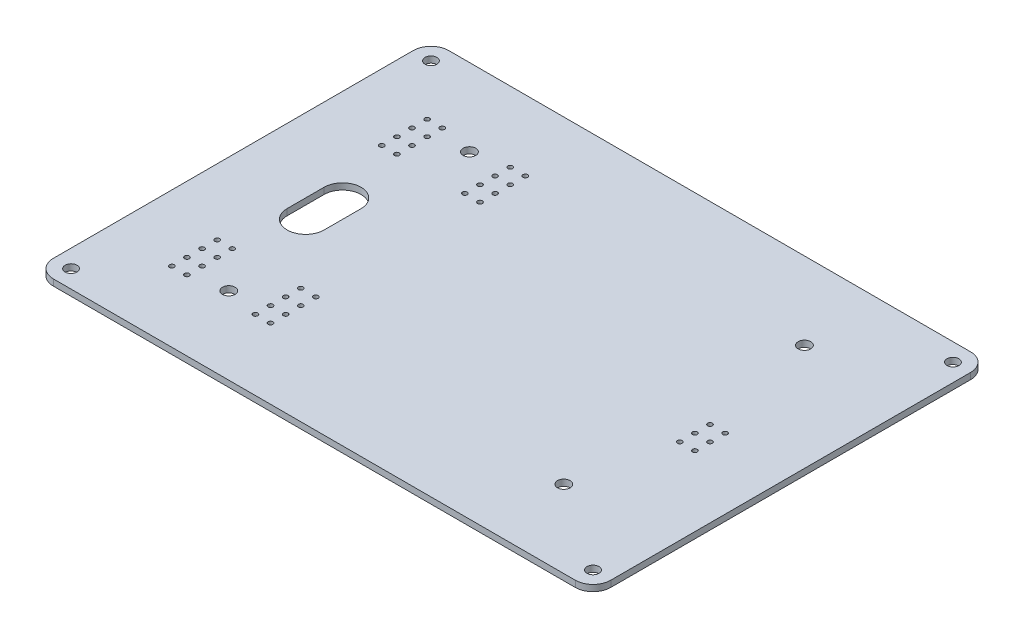
from build123d import *

# Parameters (mm, degrees)
BOSS_EXTRUDE1_DEPTH = 1.5875
SKETCH2_R           = 1.5875
CUT_EXTRUDE1_DEPTH  = 87.546171446
CUT_EXTRUDE2_DEPTH  = 87.546171446
SKETCH7_R           = 0.6
CUT_EXTRUDE3_DEPTH  = 87.546171446
SKETCH9_R           = 1.5
CUT_EXTRUDE4_DEPTH  = 87.546171446


with BuildPart() as part:
    # Sketch1 → Boss-Extrude1 (new body)
    with BuildSketch(Plane(origin=(0, 0, 0), x_dir=(1, 0, 0), z_dir=(0, 1, 0))):
        with BuildLine():
            Line((-65.410639449, -49.868760551), (66.237560551, -49.868760551))
            ThreePointArc((66.237560551, -49.868760551), (69.404663929, -48.556903378), (70.716521102, -45.3898))
            Line((70.716521102, -45.3898), (70.716521102, 45.3898))
            ThreePointArc((70.716521102, 45.3898), (69.404663929, 48.556903378), (66.237560551, 49.868760551))
            Line((66.237560551, 49.868760551), (-65.410639449, 49.868760551))
            ThreePointArc((-65.410639449, 49.868760551), (-68.577742827, 48.556903378), (-69.8896, 45.3898))
            Line((-69.8896, 45.3898), (-69.8896, -45.3898))
            ThreePointArc((-69.8896, -45.3898), (-68.577742827, -48.556903378), (-65.410639449, -49.868760551))
        make_face()
    extrude(amount=-BOSS_EXTRUDE1_DEPTH)

    # Sketch2 → Cut-Extrude1 (cut, through all)
    with BuildSketch(Plane(origin=(0, 0, 0), x_dir=(1, 0, 0), z_dir=(0, 1, 0))):
        with Locations((-40.6725, -30.35)):
            Circle(SKETCH2_R)
        with Locations((-40.6725, 30.35)):
            Circle(SKETCH2_R)
        with Locations((43.8275, 30.35)):
            Circle(SKETCH2_R)
        with Locations((43.8275, -30.35)):
            Circle(SKETCH2_R)
    extrude(amount=-CUT_EXTRUDE1_DEPTH, mode=Mode.SUBTRACT)

    # Sketch3 → Cut-Extrude2 (cut, through all)
    with BuildSketch(Plane(origin=(0, 0, 0), x_dir=(1, 0, 0), z_dir=(0, 1, 0))):
        with BuildLine():
            Line((-41.933471413, 4.284952831), (-41.933471413, -5.034952831))
            ThreePointArc((-41.933471413, -5.034952831), (-46.603471413, -9.704952831), (-51.273471413, -5.034952831))
            Line((-51.273471413, -5.034952831), (-51.273471413, 4.284952831))
            ThreePointArc((-51.273471413, 4.284952831), (-46.603471413, 8.954952831), (-41.933471413, 4.284952831))
        make_face()
    extrude(amount=-CUT_EXTRUDE2_DEPTH, mode=Mode.SUBTRACT)

    # Sketch7 → Cut-Extrude3 (cut, through all)
    with BuildSketch(Plane.XZ.offset(1.5875)):
        with Locations((49.2175, 6.483)):
            Circle(SKETCH7_R)
        with Locations((-49.3085, -32.125)):
            Circle(SKETCH7_R)
        with Locations((-28.3535, -32.125)):
            Circle(SKETCH7_R)
        with Locations((-28.3535, 20.707)):
            Circle(SKETCH7_R)
        with Locations((-49.4355, 20.707)):
            Circle(SKETCH7_R)
        with Locations((-32.1635, 20.707)):
            Circle(SKETCH7_R)
        with Locations((-53.2455, 20.707)):
            Circle(SKETCH7_R)
        with Locations((-32.1635, 28.327)):
            Circle(SKETCH7_R)
        with Locations((-53.2455, 28.327)):
            Circle(SKETCH7_R)
        with Locations((-32.1635, 24.517)):
            Circle(SKETCH7_R)
        with Locations((-53.2455, 24.517)):
            Circle(SKETCH7_R)
        with Locations((-32.1635, -28.315)):
            Circle(SKETCH7_R)
        with Locations((-53.1185, -28.315)):
            Circle(SKETCH7_R)
        with Locations((-32.1635, -32.125)):
            Circle(SKETCH7_R)
        with Locations((-53.1185, -32.125)):
            Circle(SKETCH7_R)
        with Locations((-28.3535, 24.517)):
            Circle(SKETCH7_R)
        with Locations((-49.4355, 24.517)):
            Circle(SKETCH7_R)
        with Locations((-32.1635, 32.137)):
            Circle(SKETCH7_R)
        with Locations((-53.2455, 32.137)):
            Circle(SKETCH7_R)
        with Locations((-32.1635, -20.695)):
            Circle(SKETCH7_R)
        with Locations((-53.1185, -20.695)):
            Circle(SKETCH7_R)
        with Locations((-32.1635, -24.505)):
            Circle(SKETCH7_R)
        with Locations((-53.1185, -24.505)):
            Circle(SKETCH7_R)
        with Locations((-28.3535, 32.137)):
            Circle(SKETCH7_R)
        with Locations((-49.4355, 32.137)):
            Circle(SKETCH7_R)
        with Locations((-28.3535, 28.327)):
            Circle(SKETCH7_R)
        with Locations((-49.4355, 28.327)):
            Circle(SKETCH7_R)
        with Locations((-28.3535, -24.505)):
            Circle(SKETCH7_R)
        with Locations((-49.3085, -24.505)):
            Circle(SKETCH7_R)
        with Locations((-28.3535, -28.315)):
            Circle(SKETCH7_R)
        with Locations((-49.3085, -28.315)):
            Circle(SKETCH7_R)
        with Locations((49.2175, 2.673)):
            Circle(SKETCH7_R)
        with Locations((53.0275, -1.137)):
            Circle(SKETCH7_R)
        with Locations((53.0275, 2.673)):
            Circle(SKETCH7_R)
        with Locations((53.0275, 6.483)):
            Circle(SKETCH7_R)
        with Locations((-28.3535, -20.695)):
            Circle(SKETCH7_R)
        with Locations((-49.3085, -20.695)):
            Circle(SKETCH7_R)
        with Locations((49.2175, -1.137)):
            Circle(SKETCH7_R)
    extrude(amount=-CUT_EXTRUDE3_DEPTH, mode=Mode.SUBTRACT)

    # Sketch9 → Cut-Extrude4 (cut, through all)
    with BuildSketch(Plane(origin=(0, 0, 0), x_dir=(1, 0, 0), z_dir=(0, 1, 0))):
        with Locations((-65.410639449, 45.3898)):
            Circle(SKETCH9_R)
        with Locations((-65.410639449, -45.3898)):
            Circle(SKETCH9_R)
        with Locations((66.237560551, 45.3898)):
            Circle(SKETCH9_R)
        with Locations((66.237560551, -45.3898)):
            Circle(SKETCH9_R)
    extrude(amount=-CUT_EXTRUDE4_DEPTH, mode=Mode.SUBTRACT)


solid = part.part
